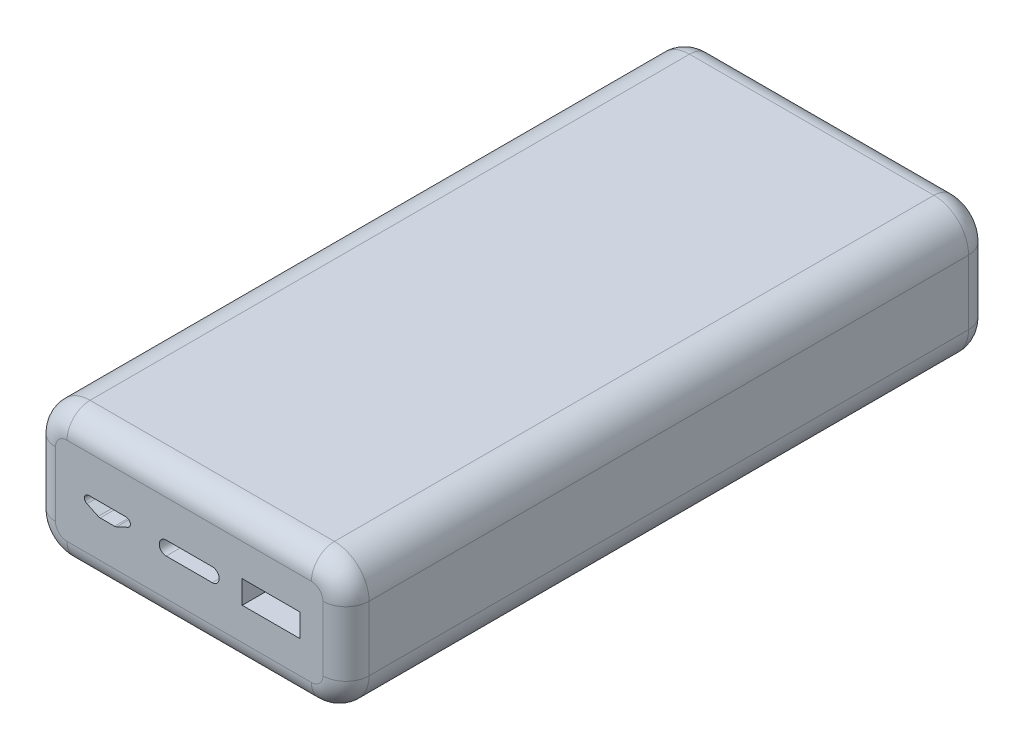
from build123d import *

# Parameters (mm, degrees)
ESQUISSE1_W             = 68
ESQUISSE1_H             = 29
BOSS_EXTRU_1_DEPTH      = 140
CONG_1_R                = 7.5
CONG_2_R                = 5
ESQUISSE2_W             = 12.5
ESQUISSE2_H             = 5
ENL_V_MAT_EXTRU_1_DEPTH = 5
CONG_3_R                = 1


with BuildPart() as part:
    # Esquisse1 → Boss.-Extru.1 (new body)
    with BuildSketch(Plane.XY):
        Rectangle(ESQUISSE1_W, ESQUISSE1_H)
    extrude(amount=BOSS_EXTRU_1_DEPTH)

    # Congé1
    cong_1_edges = [part.edges().sort_by_distance(p)[0] for p in [
        (-34, 14.5, 70),
        (34, 14.5, 70),
        (34, -14.5, 70),
        (-34, -14.5, 70),
    ]]
    fillet(cong_1_edges, radius=CONG_1_R)

    # Congé2
    cong_2_edges = [part.edges().sort_by_distance(p)[0] for p in [
        (34, 0, 0),
        (34, 0, 140),
        (-34, 0, 0),
        (0, 14.5, 0),
        (0, -14.5, 0),
        (-31.803300859, 12.303300859, 0),
        (-31.803300859, -12.303300859, 0),
        (31.803300859, 12.303300859, 0),
        (31.803300859, -12.303300859, 0),
        (0, -14.5, 140),
        (-34, 0, 140),
        (0, 14.5, 140),
        (-31.803300859, 12.303300859, 140),
        (-31.803300859, -12.303300859, 140),
        (31.803300859, 12.303300859, 140),
        (31.803300859, -12.303300859, 140),
    ]]
    fillet(cong_2_edges, radius=CONG_2_R)

    # Esquisse2 → Enlèv. mat.-Extru.1 (cut)
    with BuildSketch(Plane.XY.offset(140)):
        Polygon((-12.75, 1.5), (-22.75, 1.5), (-22.75, 0), (-19.52732972, -1.5), (-15.97267028, -1.5), (-12.75, 0), align=None)
        with BuildLine():
            Line((5, 1.5), (-5, 1.5))
            ThreePointArc((-5, 1.5), (-6.5, 0), (-5, -1.5))
            Line((-5, -1.5), (5, -1.5))
            ThreePointArc((5, -1.5), (6.5, 0), (5, 1.5))
        make_face()
        with Locations((17.75, 0)):
            Rectangle(ESQUISSE2_W, ESQUISSE2_H)
    extrude(amount=-ENL_V_MAT_EXTRU_1_DEPTH, mode=Mode.SUBTRACT)

    # Congé3
    # the kernel refuses this fillet: 1 mm, written as the material it adds along each edge
    with BuildSketch(Plane(origin=(-15.97267028, -1.5, 140), x_dir=(0.9066045100812768, 0.4219813530243817, 0), z_dir=(0, 0, -1)), Plane(origin=(-19.52732972, -1.5, 140), x_dir=(1, 0, 0), z_dir=(0, 0, -1))) as cong_3_piece_1:
        with BuildLine():
            CenterArc((CONG_3_R * 0.221326106591, -CONG_3_R), CONG_3_R, 90, 24.959741925)
            Line((-CONG_3_R * 0.200655246434, -CONG_3_R * 0.0933954899187), (0, 0))
            Line((0, 0), (CONG_3_R * 0.221326106591, 0))
        make_face()
    extrude(amount=5.553315266)
    with BuildSketch(Plane(origin=(-22.75, 0, 140), x_dir=(0.9066045100812758, -0.42198135302438383, 0), z_dir=(0, 0, -1))) as cong_3_piece_2:
        with BuildLine():
            CenterArc((CONG_3_R * 0.637564274773, -CONG_3_R), CONG_3_R, 90, 65.040258075)
            Line((-CONG_3_R * 0.269040235309, -CONG_3_R * 0.578018646976), (0, 0))
            Line((0, 0), (CONG_3_R * 0.637564274773, 0))
        make_face()
    extrude(amount=6.593910687)
    with BuildSketch(Plane(origin=(-22.75, 1.5, 140), x_dir=(0, -1, 0), z_dir=(0, 0, -1)), Plane(origin=(-12.75, 1.5, 140), x_dir=(-1, 0, 0), z_dir=(0, 0, -1))) as cong_3_piece_3:
        with BuildLine():
            CenterArc((CONG_3_R, -CONG_3_R), CONG_3_R, 90, 90)
            Line((0, -CONG_3_R), (0, 0))
            Line((0, 0), (CONG_3_R, 0))
        make_face()
    extrude(amount=7.5)
    with BuildSketch(Plane(origin=(-12.75, 0, 140), x_dir=(-0.906604510081276, -0.4219813530243839, 0), z_dir=(0, 0, -1))) as cong_3_piece_4:
        with BuildLine():
            CenterArc((CONG_3_R * 0.637564274773, CONG_3_R), CONG_3_R, 204.959741925, 65.040258075)
            Line((-CONG_3_R * 0.269040235309, CONG_3_R * 0.578018646976), (0, 0))
            Line((0, 0), (CONG_3_R * 0.637564274773, 0))
        make_face()
    extrude(amount=6.593910687)


solid = part.part
